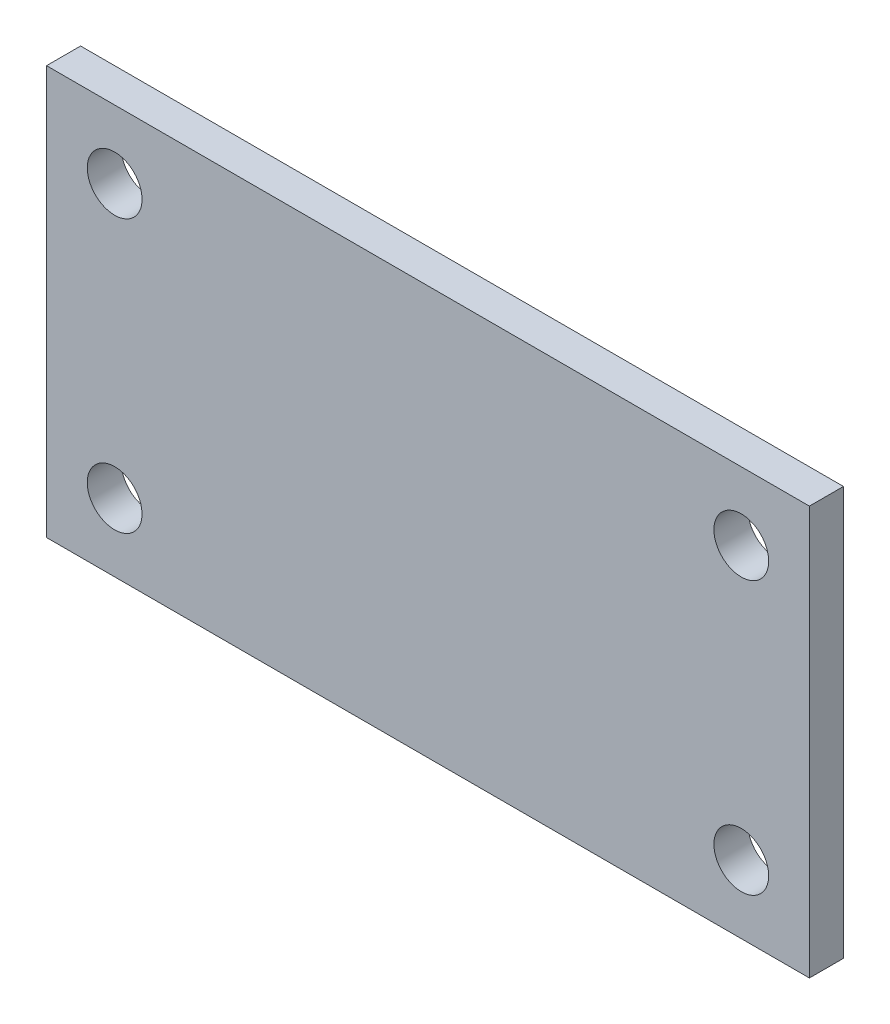
from build123d import *

# Parameters (mm, degrees)
SKETCH1_W           = 71.12
SKETCH1_H           = 38.1
BOSS_EXTRUDE1_DEPTH = 3.175
CUT_EXTRUDE1_REACH  = 82.745
SKETCH2_R           = 2.5527


with BuildPart() as part:
    # Sketch1 → Boss-Extrude1 (new body)
    with BuildSketch(Plane.XY):
        with Locations((35.56, 19.05)):
            Rectangle(SKETCH1_W, SKETCH1_H)
    extrude(amount=BOSS_EXTRUDE1_DEPTH)

    # Sketch2 → Cut-Extrude1 (cut, up to next)
    with BuildSketch(Plane(origin=(0, 0, 0), x_dir=(-1, 0, 0), z_dir=(0, 0, -1)), mode=Mode.PRIVATE) as cut_extrude1_sk1:
        with Locations((-6.35, 6.35)):
            Circle(SKETCH2_R)
    cut_extrude1_tool1 = extrude(cut_extrude1_sk1.sketch, amount=-CUT_EXTRUDE1_REACH, mode=Mode.PRIVATE) & part.part
    # Sketch2 → Cut-Extrude1 (cut, up to next)
    with BuildSketch(Plane(origin=(0, 0, 0), x_dir=(-1, 0, 0), z_dir=(0, 0, -1)), mode=Mode.PRIVATE) as cut_extrude1_sk2:
        with Locations((-64.77, 6.35)):
            Circle(SKETCH2_R)
    cut_extrude1_tool2 = extrude(cut_extrude1_sk2.sketch, amount=-CUT_EXTRUDE1_REACH, mode=Mode.PRIVATE) & part.part
    # Sketch2 → Cut-Extrude1 (cut, up to next)
    with BuildSketch(Plane(origin=(0, 0, 0), x_dir=(-1, 0, 0), z_dir=(0, 0, -1)), mode=Mode.PRIVATE) as cut_extrude1_sk3:
        with Locations((-64.77, 31.75)):
            Circle(SKETCH2_R)
    cut_extrude1_tool3 = extrude(cut_extrude1_sk3.sketch, amount=-CUT_EXTRUDE1_REACH, mode=Mode.PRIVATE) & part.part
    # Sketch2 → Cut-Extrude1 (cut, up to next)
    with BuildSketch(Plane(origin=(0, 0, 0), x_dir=(-1, 0, 0), z_dir=(0, 0, -1)), mode=Mode.PRIVATE) as cut_extrude1_sk4:
        with Locations((-6.35, 31.75)):
            Circle(SKETCH2_R)
    cut_extrude1_tool4 = extrude(cut_extrude1_sk4.sketch, amount=-CUT_EXTRUDE1_REACH, mode=Mode.PRIVATE) & part.part
    add(cut_extrude1_tool1.solids().sort_by_distance((6.35, 6.35, 0))[0], mode=Mode.SUBTRACT)
    add(cut_extrude1_tool2.solids().sort_by_distance((64.77, 6.35, 0))[0], mode=Mode.SUBTRACT)
    add(cut_extrude1_tool3.solids().sort_by_distance((64.77, 31.75, 0))[0], mode=Mode.SUBTRACT)
    add(cut_extrude1_tool4.solids().sort_by_distance((6.35, 31.75, 0))[0], mode=Mode.SUBTRACT)


solid = part.part
